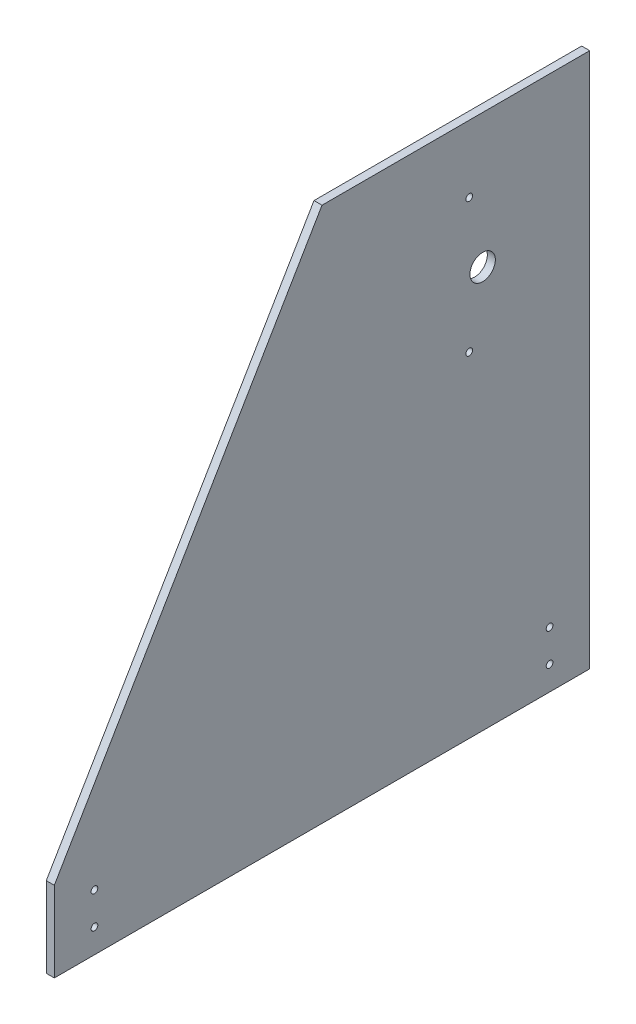
from build123d import *

# Parameters (mm, degrees)
SKETCH1_R           = 2.5
SKETCH1_R_2         = 9.5
BOSS_EXTRUDE1_DEPTH = 6


with BuildPart() as part:
    # Sketch1 → Boss-Extrude1 (new body)
    with BuildSketch(Plane(origin=(0, 0, 0), x_dir=(0, 0, -1), z_dir=(1, 0, 0))):
        Polygon((0, 0), (400, 0), (400, 400), (200, 400), (0, 60), align=None)
        with Locations((30, 42)):
            Circle(SKETCH1_R, mode=Mode.SUBTRACT)
        with Locations((30, 18)):
            Circle(SKETCH1_R, mode=Mode.SUBTRACT)
        with Locations((370, 18)):
            Circle(SKETCH1_R, mode=Mode.SUBTRACT)
        with Locations((370, 42)):
            Circle(SKETCH1_R, mode=Mode.SUBTRACT)
        with Locations((310, 350)):
            Circle(SKETCH1_R, mode=Mode.SUBTRACT)
        with Locations((310, 250)):
            Circle(SKETCH1_R, mode=Mode.SUBTRACT)
        with Locations((320, 300)):
            Circle(SKETCH1_R_2, mode=Mode.SUBTRACT)
    extrude(amount=BOSS_EXTRUDE1_DEPTH)


solid = part.part
